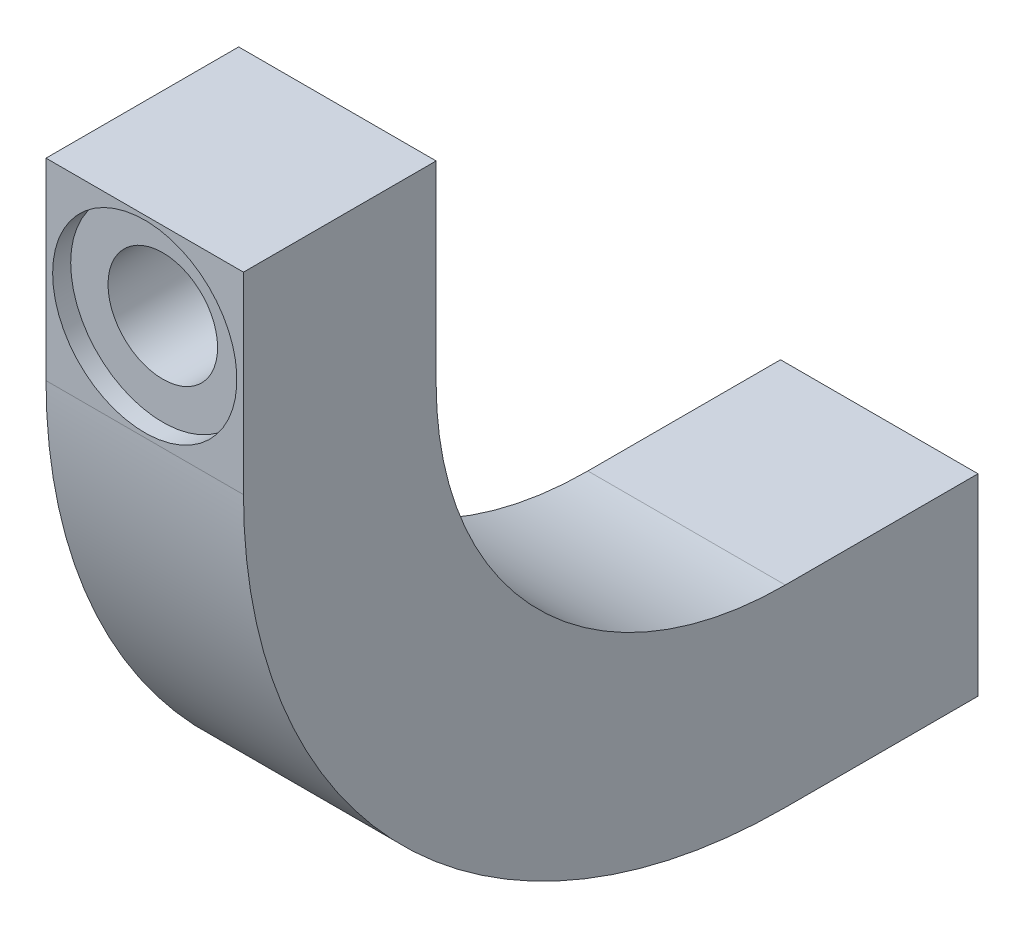
from build123d import *

# Parameters (mm, degrees)
BOSS_EXTRUDE1_DEPTH      = 4.1
BOSS_EXTRUDE1_DEPTH_BACK = 4.1
SKETCH7_R                = 1.75
CUT_EXTRUDE1_DEPTH       = 38.700265251
SKETCH12_R               = 2.275
CUT_EXTRUDE7_DEPTH       = 6
SKETCH14_R               = 3.825
CUT_EXTRUDE10_DEPTH      = 0.75
SKETCH15_R               = 1.5
CUT_EXTRUDE11_DEPTH      = 6


with BuildPart() as part:
    # Sketch5 → Boss-Extrude1 (new, two sides: drawn at the far end of the back side and taken through both)
    with BuildSketch(Plane(origin=(0, 0, 0), x_dir=(0, 0, -1), z_dir=(1, 0, 0)).offset(-BOSS_EXTRUDE1_DEPTH_BACK)):
        with BuildLine():
            Line((-18.5, 4), (-18.5, 0))
            Line((-18.5, 0), (-18.5, -4))
            ThreePointArc((-18.5, -4), (-14.253048327, -14.253048327), (-4, -18.5))
            Line((-4, -18.5), (0, -18.5))
            Line((0, -18.5), (4, -18.5))
            Line((4, -18.5), (4, -26.5))
            Line((4, -26.5), (-4, -26.5))
            ThreePointArc((-4, -26.5), (-19.909902577, -19.909902577), (-26.5, -4))
            Line((-26.5, -4), (-26.5, 4))
            Line((-26.5, 4), (-18.5, 4))
        make_face()
    extrude(amount=BOSS_EXTRUDE1_DEPTH + BOSS_EXTRUDE1_DEPTH_BACK)

    # Sketch7 → Cut-Extrude1 (cut, through all)
    with BuildSketch(Plane.XY):
        Circle(SKETCH7_R)
    extrude(amount=CUT_EXTRUDE1_DEPTH, mode=Mode.SUBTRACT)

    # Sketch12 → Cut-Extrude7 (cut)
    with BuildSketch(Plane.XY.offset(26.5)):
        Circle(SKETCH12_R)
    extrude(amount=-CUT_EXTRUDE7_DEPTH, mode=Mode.SUBTRACT)

    # Sketch14 → Cut-Extrude10 (cut)
    with BuildSketch(Plane(origin=(0, 0, 26.5), x_dir=(1, 0, 0), z_dir=(0, 0, -1))):
        Circle(SKETCH14_R)
    extrude(amount=CUT_EXTRUDE10_DEPTH, mode=Mode.SUBTRACT)

    # Sketch15 → Cut-Extrude11 (cut)
    with BuildSketch(Plane.XZ.offset(26.5)):
        Circle(SKETCH15_R)
    extrude(amount=-CUT_EXTRUDE11_DEPTH, mode=Mode.SUBTRACT)


solid = part.part
